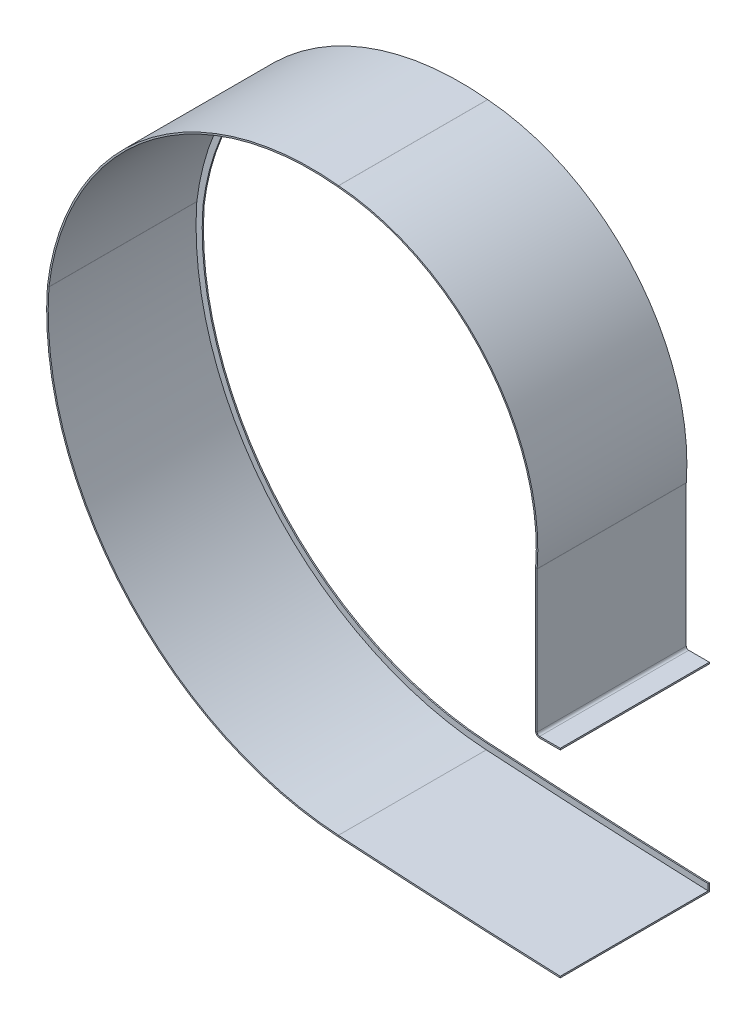
from build123d import *

# Parameters (mm, degrees)
BASE_FLANGE1_DEPTH      = 242
EXTRUDE_THIN1_DEPTH     = 2
CUT_EXTRUDE3_DEPTH      = 1473.940690723
CUT_EXTRUDE3_DEPTH_BACK = 1473.940690723


# Read off the part's stored shape, not the designer's step: Base-Flange1
with BuildPart() as part:
    # Base-Flange1 outline → Base-Flange1 (new body)
    with BuildSketch(Plane.XY):
        with BuildLine():
            Line((871.769127642, 521.057153497), (905.269127642, 521.057153497))
            Line((905.269127642, 521.057153497), (905.269127642, 523.557153497))
            Line((905.269127642, 523.557153497), (871.769127642, 523.557153497))
            ThreePointArc((871.769127642, 523.557153497), (868.940700517, 524.728726372), (867.769127642, 527.557153497))
            Line((867.769127642, 527.557153497), (867.769127642, 756.805124112))
            ThreePointArc((867.769127642, 756.805124112), (867.77210353, 756.959390926), (867.781026767, 757.1134282))
            ThreePointArc((867.781026767, 757.1134282), (784.657582784, 1012.417540201), (545.544536696, 1134.54308108))
            ThreePointArc((545.544536696, 1134.54308108), (545.498432474, 1134.547059372), (545.45237736, 1134.551570763))
            ThreePointArc((545.45237736, 1134.551570763), (231.971479061, 1042.712636382), (72.799654121, 757.46012787))
            ThreePointArc((72.799654121, 757.46012787), (72.781664067, 757.29368801), (72.76796633, 757.126840052))
            ThreePointArc((72.76796633, 757.126840052), (196.842388714, 389.59572995), (545.115755529, 218.776406833))
            ThreePointArc((545.115755529, 218.776406833), (725.093462287, 208.692500871), (905.169857989, 200.559125168))
            Line((905.169857989, 200.559125168), (905.269127642, 203.057153497))
            ThreePointArc((905.269127642, 203.057153497), (725.219790585, 211.189307063), (545.269127642, 221.271697797))
            ThreePointArc((545.269127642, 221.271697797), (198.721595151, 391.244542603), (75.262011332, 756.954388532))
            ThreePointArc((75.262011332, 756.954388532), (75.270440709, 757.057064199), (75.281511511, 757.159488728))
            ThreePointArc((75.281511511, 757.159488728), (233.530616685, 1040.758387199), (545.194264845, 1132.064930876))
            ThreePointArc((545.194264845, 1132.064930876), (545.269104404, 1132.057599865), (545.344023766, 1132.051135141))
            ThreePointArc((545.344023766, 1132.051135141), (782.756272141, 1010.794266398), (865.28846372, 757.306118255))
            ThreePointArc((865.28846372, 757.306118255), (865.27396346, 757.055807685), (865.269127642, 756.805124112))
            Line((865.269127642, 756.805124112), (865.269127642, 527.557153497))
            ThreePointArc((865.269127642, 527.557153497), (867.172933564, 522.960959419), (871.769127642, 521.057153497))
        make_face()
    extrude(amount=BASE_FLANGE1_DEPTH)

    # Sketch9 → Extrude-Thin1 (add)
    with BuildSketch(Plane.XY):
        with BuildLine():
            Line((905.269127642, 203.057153497), (905.269127642, 521.057153497))
            Line((905.269127642, 521.057153497), (865.269127642, 521.057153497))
            Line((865.269127642, 521.057153497), (865.269127642, 757.057153497))
            ThreePointArc((865.269127642, 757.057153497), (782.812941082, 1010.7278743), (545.269127642, 1132.057153497))
            ThreePointArc((545.269127642, 1132.057153497), (233.519744905, 1040.749713195), (75.269127642, 757.057153497))
            ThreePointArc((75.269127642, 757.057153497), (198.687627947, 391.283260157), (545.269127642, 221.271697797))
            ThreePointArc((545.269127642, 221.271697797), (725.219790584, 211.189307063), (905.269127642, 203.057153497))
        make_face()
        with BuildLine():
            Line((895.269127642, 213.465697296), (895.269127642, 511.057153497))
            Line((895.269127642, 511.057153497), (855.269127642, 511.057153497))
            Line((855.269127642, 511.057153497), (855.269127642, 757.449526591))
            ThreePointArc((855.269127642, 757.449526591), (775.293432889, 1004.134267456), (544.352108556, 1122.098574947))
            ThreePointArc((544.352108556, 1122.098574947), (239.902349284, 1033.049195687), (85.227547592, 756.110297031))
            ThreePointArc((85.227547592, 756.110297031), (206.289423946, 397.781672568), (545.882616091, 231.252861653))
            ThreePointArc((545.882616091, 231.252861653), (720.529084068, 221.440244534), (895.269127642, 213.465697296))
        make_face(mode=Mode.SUBTRACT)
    extrude(amount=EXTRUDE_THIN1_DEPTH)

    # Sketch11 → Cut-Extrude3 (cut, two sides: drawn at the far end of the back side and taken through both)
    with BuildSketch(Plane.XY.offset(2).offset(-CUT_EXTRUDE3_DEPTH_BACK)):
        Polygon((905.269127642, 521.057153497), (895.269127642, 521.057153497), (855.269127642, 521.057153497), (855.269127642, 511.057153497), (895.269127642, 511.057153497), (895.269127642, 213.465697296), (905.269127642, 213.465697296), align=None)
    extrude(amount=CUT_EXTRUDE3_DEPTH + CUT_EXTRUDE3_DEPTH_BACK, mode=Mode.SUBTRACT)


solid = part.part
